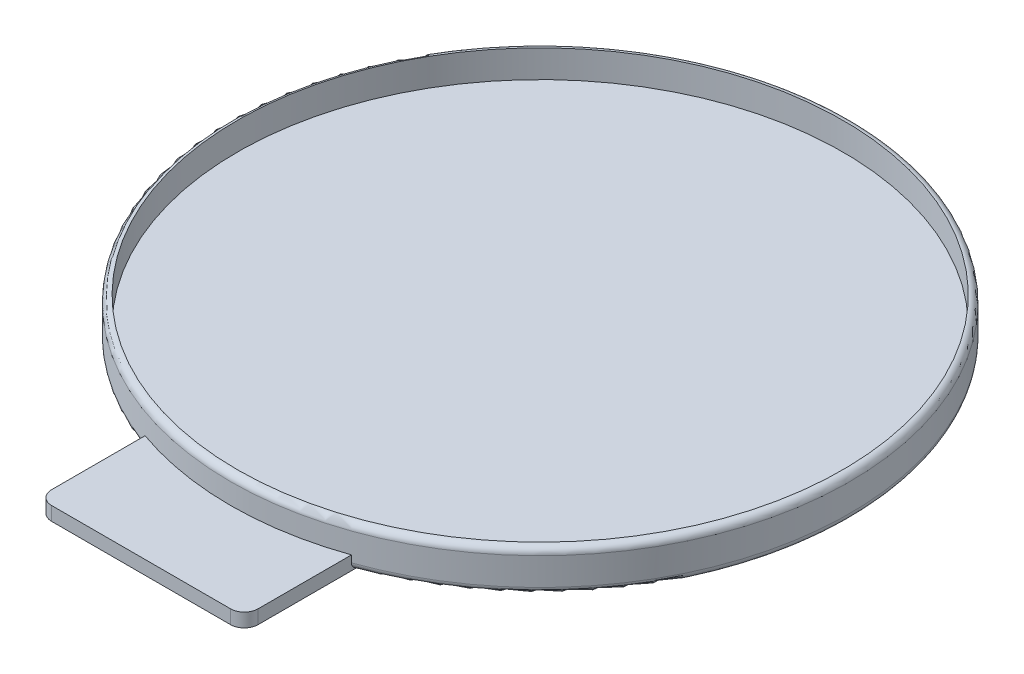
from build123d import *

# Parameters (mm, degrees)
SKETCH1_R           = 225
BOSS_EXTRUDE1_DEPTH = 30
SKETCH2_R           = 220
CUT_EXTRUDE1_DEPTH  = 20
SKETCH4_W           = 150
SKETCH4_H           = 10
BOSS_EXTRUDE3_DEPTH = 290
FILLET1_R           = 10
FILLET2_R           = 5


with BuildPart() as part:
    # Sketch1 → Boss-Extrude1 (new body)
    with BuildSketch(Plane(origin=(0, 0, 0), x_dir=(1, 0, 0), z_dir=(0, 1, 0))):
        with Locations(Location((0, 0, 0), (0, 0, 270))):
            Circle(SKETCH1_R)
    extrude(amount=BOSS_EXTRUDE1_DEPTH)

    # Sketch2 → Cut-Extrude1 (cut)
    with BuildSketch(Plane(origin=(0, 30, 0), x_dir=(1, 0, 0), z_dir=(0, 1, 0))):
        with Locations(Location((0, 0, 0), (0, 0, 270))):
            Circle(SKETCH2_R)
    extrude(amount=-CUT_EXTRUDE1_DEPTH, mode=Mode.SUBTRACT)

    # Sketch4 → Boss-Extrude3 (add)
    with BuildSketch(Plane.XY):
        with Locations((0, 5)):
            Rectangle(SKETCH4_W, SKETCH4_H)
    extrude(amount=BOSS_EXTRUDE3_DEPTH)

    # Fillet1
    fillet1_edges = [part.edges().sort_by_distance(p)[0] for p in [
        (75, 5, 290),
        (-75, 5, 290),
    ]]
    fillet(fillet1_edges, radius=FILLET1_R)

    # Fillet2
    fillet2_edges = [part.edges().sort_by_distance(p)[0] for p in [
        (0, 0, -225),
        (0, 30, -225),
    ]]
    fillet(fillet2_edges, radius=FILLET2_R - 0.0001)  # a hair under: the kernel refuses the full size


solid = part.part
